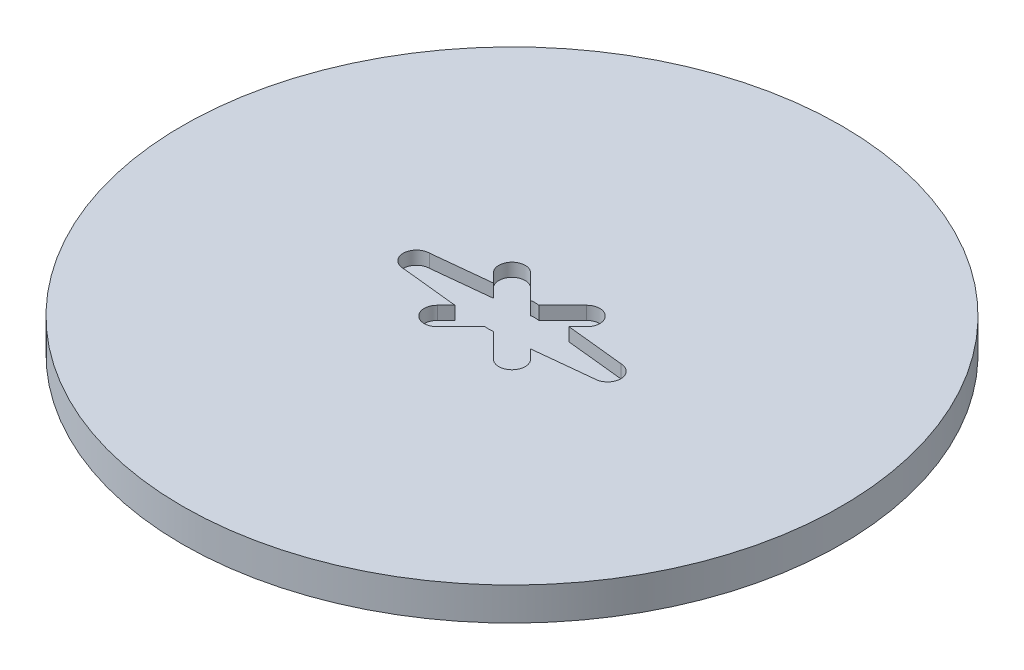
from build123d import *

# Parameters (mm, degrees)
SKETCH1_R           = 50
BOSS_EXTRUDE1_DEPTH = 5
CUT_EXTRUDE1_DEPTH  = 2


with BuildPart() as part:
    # Sketch1 → Boss-Extrude1 (new body)
    with BuildSketch(Plane(origin=(0, 0, 0), x_dir=(1, 0, 0), z_dir=(0, 1, 0))):
        Circle(SKETCH1_R)
    extrude(amount=BOSS_EXTRUDE1_DEPTH)

    # Sketch2 → Cut-Extrude1 (cut)
    with BuildSketch(Plane(origin=(0, 5, 0), x_dir=(1, 0, 0), z_dir=(0, 1, 0))):
        with BuildLine():
            Line((-14.5, -2), (-5.745618638, -2.917191513))
            Line((-5.745618638, -2.917191513), (-7.071067812, -4.242640687))
            ThreePointArc((-7.071067812, -4.242640687), (-7.071067812, -7.071067812), (-4.242640687, -7.071067812))
            Line((-4.242640687, -7.071067812), (-0.616796039, -3.445223164))
            ThreePointArc((-0.616796039, -3.445223164), (0, -3.5), (0.616796039, -3.445223164))
            Line((0.616796039, -3.445223164), (4.242640687, -7.071067812))
            ThreePointArc((4.242640687, -7.071067812), (7.071067812, -7.071067812), (7.071067812, -4.242640687))
            Line((7.071067812, -4.242640687), (5.745618638, -2.917191513))
            Line((5.745618638, -2.917191513), (14.5, -2))
            ThreePointArc((14.5, -2), (16.5, 0), (14.5, 2))
            Line((14.5, 2), (5.745618638, 2.917191513))
            Line((5.745618638, 2.917191513), (7.071067812, 4.242640687))
            ThreePointArc((7.071067812, 4.242640687), (7.071067812, 7.071067812), (4.242640687, 7.071067812))
            Line((4.242640687, 7.071067812), (0.616796039, 3.445223164))
            ThreePointArc((0.616796039, 3.445223164), (0, 3.5), (-0.616796039, 3.445223164))
            Line((-0.616796039, 3.445223164), (-4.242640687, 7.071067812))
            ThreePointArc((-4.242640687, 7.071067812), (-7.071067812, 7.071067812), (-7.071067812, 4.242640687))
            Line((-7.071067812, 4.242640687), (-5.745618638, 2.917191513))
            Line((-5.745618638, 2.917191513), (-14.5, 2))
            ThreePointArc((-14.5, 2), (-16.5, 0), (-14.5, -2))
        make_face()
    extrude(amount=-CUT_EXTRUDE1_DEPTH, mode=Mode.SUBTRACT)


solid = part.part
